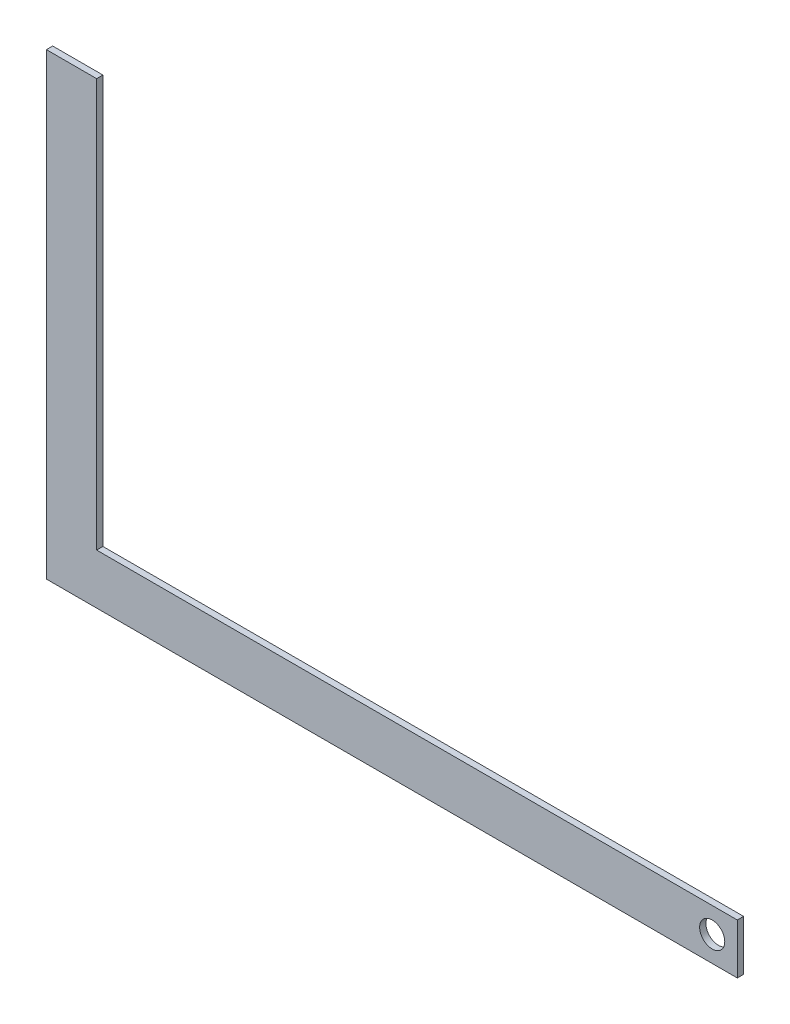
from build123d import *

# Parameters (mm, degrees)
SKETCH1_W           = 349.25
SKETCH1_H           = 25.4
SKETCH1_R           = 6.35
BOSS_EXTRUDE1_DEPTH = 3.175
SKETCH2_W           = 25.4
SKETCH2_H           = 206.375
BOSS_EXTRUDE2_DEPTH = 3.175


with BuildPart() as part:
    # Sketch1 → Boss-Extrude1 (new body)
    with BuildSketch(Plane.XY):
        with Locations((174.625, 12.7)):
            Rectangle(SKETCH1_W, SKETCH1_H)
        with Locations((336.55, 12.7)):
            Circle(SKETCH1_R, mode=Mode.SUBTRACT)
    extrude(amount=BOSS_EXTRUDE1_DEPTH)

    # Sketch2 → Boss-Extrude2 (add)
    with BuildSketch(Plane.XY.offset(3.175)):
        with Locations((12.7, 128.5875)):
            Rectangle(SKETCH2_W, SKETCH2_H)
    extrude(amount=-BOSS_EXTRUDE2_DEPTH)


solid = part.part
